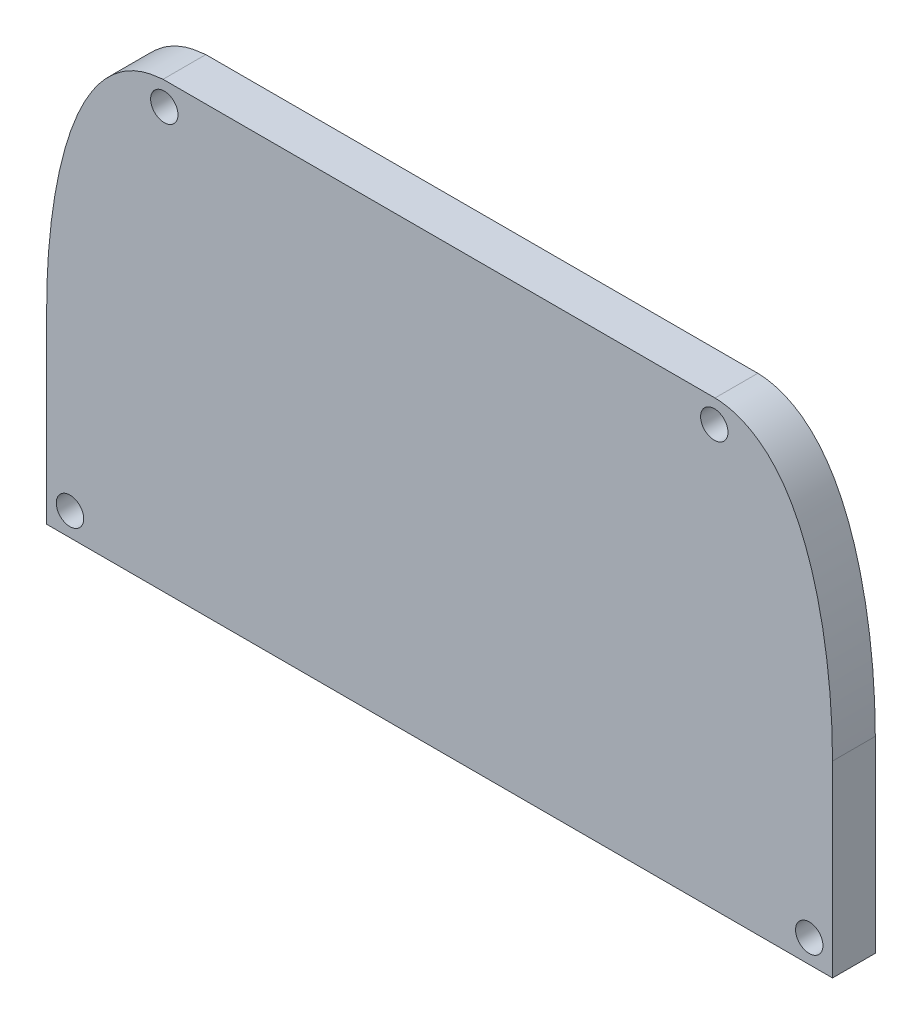
from build123d import *

# Parameters (mm, degrees)
BOSS_EXTRUDE1_DEPTH = 3.125
SKETCH2_R           = 1
CUT_EXTRUDE1_DEPTH  = 48.430902888


with BuildPart() as part:
    # Sketch1 → Boss-Extrude1 (new body)
    with BuildSketch(Plane.XY):
        with BuildLine():
            Line((-20.203129623, 37.632896645), (20.117151565, 37.632896645))
            add(Edge.make_bspline(
                [(20.117151565, 37.632896645), (21.156753823, 37.606159781), (22.735888945, 36.946533693), (23.719953098, 36.241613805), (24.317335316, 35.668339909), (24.792218887, 35.126310345), (25.193770163, 34.589480181), (25.580240934, 33.994335549), (25.880692384, 33.46392706), (26.075964751, 33.084941816), (26.275781579, 32.67284556), (26.502816287, 32.163376648), (26.759952395, 31.523411695), (27.000032858, 30.857574813), (27.232618705, 30.135363669), (27.413566154, 29.510661865), (27.590821945, 28.836314545), (27.75544118, 28.141087546), (27.912774777, 27.399744162), (28.039097082, 26.736354092), (28.187033328, 25.870889382), (28.364781589, 24.612889619), (28.514705741, 23.210461087), (28.609846525, 21.960809811), (28.647831579, 21.199455034), (28.662990289, 20.794064837), (28.670134369, 20.567790106), (28.675595157, 20.368785847), (28.67824506, 20.258008881), (28.682159285, 20.07948003), (28.692137779, 19.551762601), (28.7, 18.957307)],
                knots=[0.00028806, 0.00028806, 0.00028806, 0.094004954, 0.156482883, 0.20334133, 0.234580294, 0.265819259, 0.297058223, 0.328297188, 0.351726411, 0.367345894, 0.390775117, 0.422014081, 0.453253046, 0.484492011, 0.515730975, 0.54696994, 0.578208904, 0.609447869, 0.640686833, 0.671925798, 0.718784245, 0.781262174, 0.843740103, 0.89059855, 0.914027773, 0.925742385, 0.933552126, 0.941361867, 0.949171608, 0.96088622, 0.999934926, 0.999934926, 0.999934926], degree=2))
            Line((28.7, 18.957307), (28.7, 5.232896645))
            Line((28.7, 5.232896645), (-28.7, 5.232896645))
            Line((-28.7, 5.232896645), (-28.7, 18.957350967))
            add(Edge.make_bspline(
                [(-28.7, 18.957350967), (-28.692153628, 19.549545173), (-28.682232605, 20.075054954), (-28.678344259, 20.252853658), (-28.675719104, 20.3629486), (-28.670287366, 20.561677149), (-28.663195056, 20.787370847), (-28.648165049, 21.191436434), (-28.610617229, 21.948213832), (-28.516251848, 23.193564784), (-28.367452183, 24.590209841), (-28.192222461, 25.837092492), (-28.046555777, 26.694980708), (-27.922131578, 27.352877518), (-27.768106629, 28.084277414), (-27.606991073, 28.771118762), (-27.433567128, 29.437846176), (-27.257321923, 30.05373298), (-27.026905593, 30.778492833), (-26.789755448, 31.444828665), (-26.535970956, 32.084841789), (-26.279546027, 32.668726251), (-25.94722889, 33.343140856), (-25.626981996, 33.916618376), (-25.234153949, 34.531476594), (-24.838870032, 35.068185965), (-24.376862371, 35.604879165), (-23.771620317, 36.195487969), (-22.810285035, 36.909717798), (-21.778782832, 37.349377848), (-21.236583799, 37.484738331), (-20.629943321, 37.597925734), (-20.203129623, 37.632896645)],
                knots=[6.5434e-05, 6.5434e-05, 6.5434e-05, 0.039109453, 0.050822658, 0.058631462, 0.066440266, 0.07424907, 0.085962275, 0.109388687, 0.156241509, 0.218711939, 0.28118237, 0.328035192, 0.359270407, 0.390505622, 0.421740837, 0.452976053, 0.484211268, 0.515446483, 0.546681698, 0.577916913, 0.609152128, 0.640387343, 0.671622558, 0.702857773, 0.734092988, 0.765328203, 0.796563418, 0.843416241, 0.905886671, 0.94493069, 0.960548298, 0.999592316, 0.999592316, 0.999592316], degree=2))
        make_face()
    extrude(amount=BOSS_EXTRUDE1_DEPTH)

    # Sketch2 → Cut-Extrude1 (cut, through all)
    with BuildSketch(Plane.XY.offset(3.125)):
        with Locations((-27, 6.932896645)):
            Circle(SKETCH2_R)
        with Locations((-20.109740195, 35.932896645)):
            Circle(SKETCH2_R)
        with Locations((20.062838944, 35.932896645)):
            Circle(SKETCH2_R)
        with Locations((27, 6.932896645)):
            Circle(SKETCH2_R)
    extrude(amount=-CUT_EXTRUDE1_DEPTH, mode=Mode.SUBTRACT)


solid = part.part
